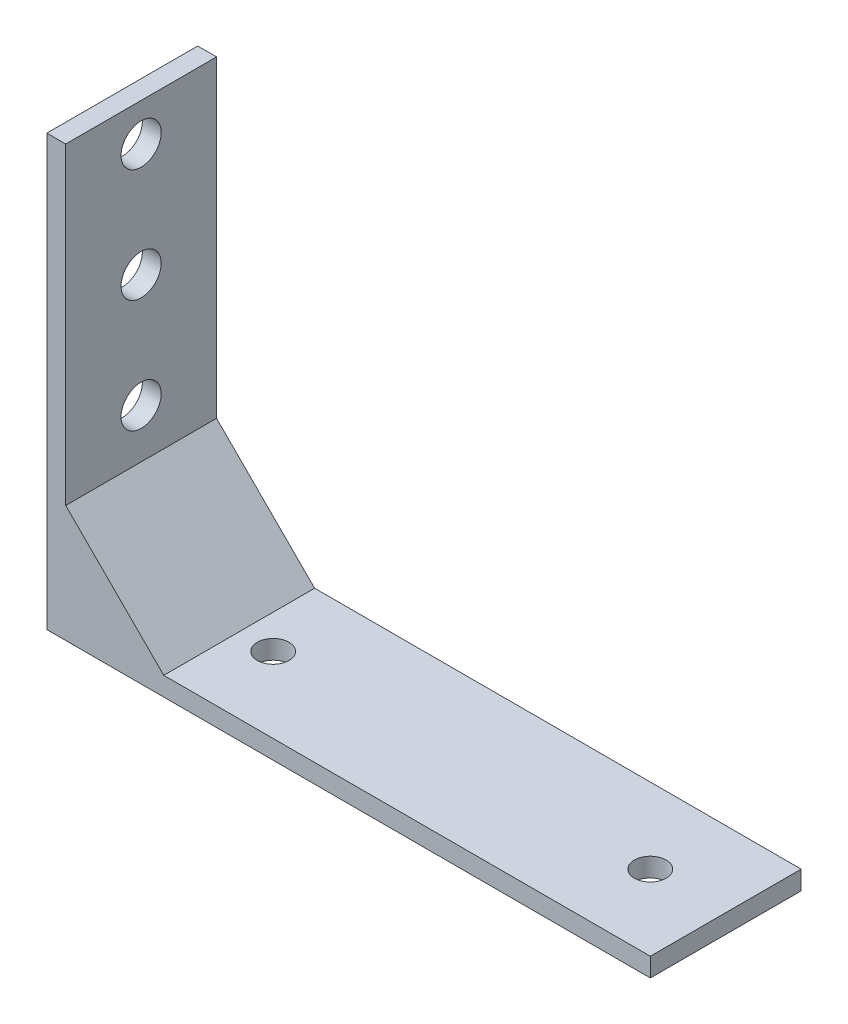
from build123d import *

# Parameters (mm, degrees)
BOSS_EXTRUDE1_DEPTH = 25.4
SKETCH2_R           = 2.667
CUT_EXTRUDE1_DEPTH  = 25.4
SKETCH3_R           = 3.3782
CUT_EXTRUDE2_DEPTH  = 128.310769772
BOSS_EXTRUDE2_DEPTH = 25.4


with BuildPart() as part:
    # Sketch1 → Boss-Extrude1 (new body)
    with BuildSketch(Plane.XY):
        Polygon((0, 3.175), (0, 0), (3.175, 0), (101.6, 0), (101.6, 3.175), (3.175, 3.175), (3.175, 72.39), (0, 72.39), align=None)
    extrude(amount=BOSS_EXTRUDE1_DEPTH)

    # Sketch2 → Cut-Extrude1 (cut)
    with BuildSketch(Plane(origin=(0, 3.175, 0), x_dir=(1, 0, 0), z_dir=(0, 1, 0))):
        with Locations((88.9, -12.7)):
            Circle(SKETCH2_R)
        with Locations((25.4, -12.7)):
            Circle(SKETCH2_R)
    extrude(amount=-CUT_EXTRUDE1_DEPTH, mode=Mode.SUBTRACT)

    # Sketch3 → Cut-Extrude2 (cut, through all)
    with BuildSketch(Plane.ZY):
        with Locations((12.7, 27.94)):
            Circle(SKETCH3_R)
        with Locations((12.7, 46.99)):
            Circle(SKETCH3_R)
        with Locations((12.7, 66.04)):
            Circle(SKETCH3_R)
    extrude(amount=-CUT_EXTRUDE2_DEPTH, mode=Mode.SUBTRACT)

    # Sketch4 → Boss-Extrude2 (add)
    with BuildSketch(Plane.XY.offset(25.4)):
        Polygon((3.175, 19.685), (19.685, 3.175), (3.175, 3.175), align=None)
    extrude(amount=-BOSS_EXTRUDE2_DEPTH)


solid = part.part
